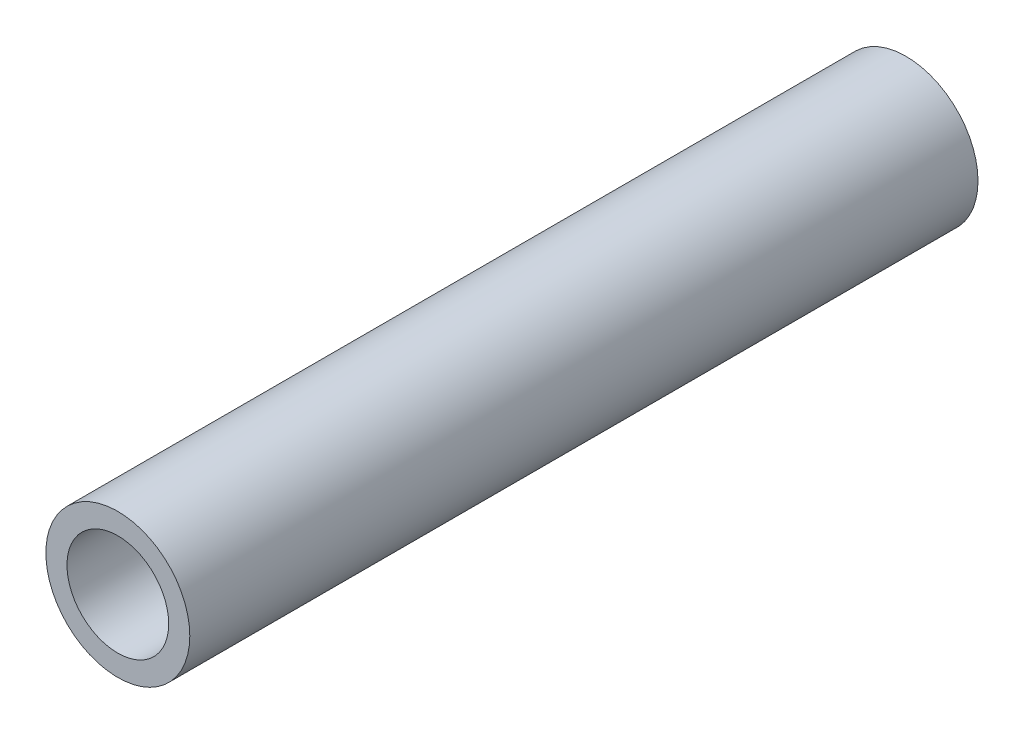
from build123d import *

# Parameters (mm, degrees)
SKETCH1_R           = 13.335
SKETCH1_R_2         = 9.4234
EXTRUDE_THIN1_DEPTH = 73.025


with BuildPart() as part:
    # Sketch1 → Extrude-Thin1 (new, symmetric)
    with BuildSketch(Plane.XY):
        Circle(SKETCH1_R)
        Circle(SKETCH1_R_2, mode=Mode.SUBTRACT)
    extrude(amount=EXTRUDE_THIN1_DEPTH, both=True)


solid = part.part
